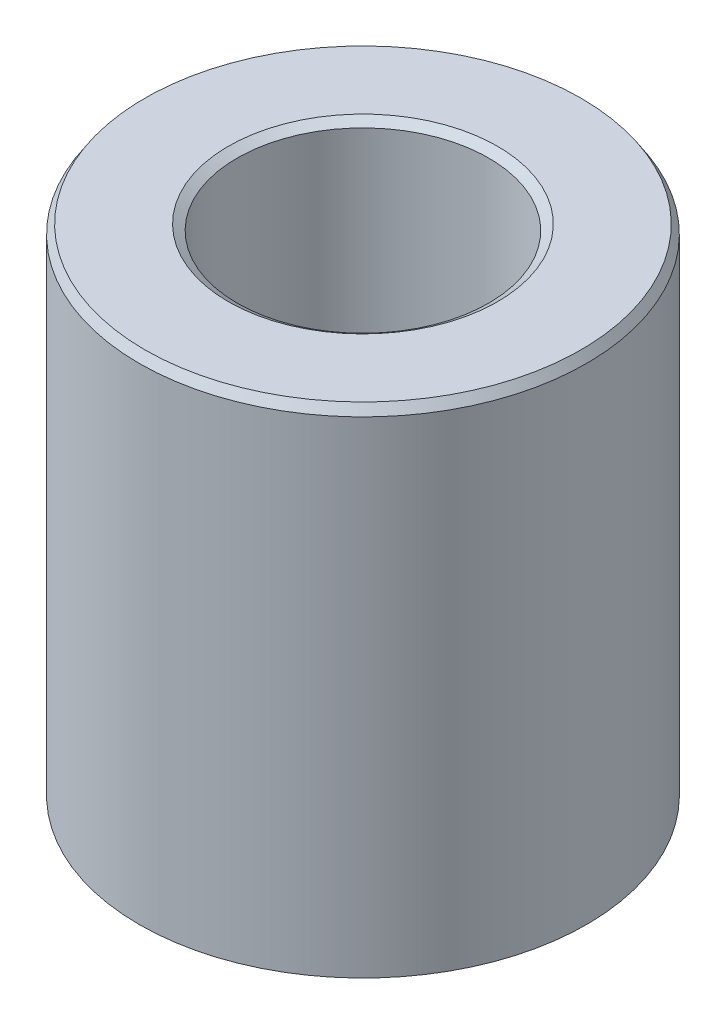
from build123d import *
from OCP.BRepFilletAPI import BRepFilletAPI_MakeChamfer

# Parameters (mm, degrees)
SKETCH1_R           = 32.5
BOSS_EXTRUDE1_DEPTH = 72.711020026
SKETCH2_R           = 18.267022671
CUT_EXTRUDE1_DEPTH  = 87.019721188
CHAMFER1_SIZE       = 1.29037095
CHAMFER1_SIZE2      = 0.829573823


with BuildPart() as part:
    # Sketch1 → Boss-Extrude1 (new body)
    with BuildSketch(Plane(origin=(0, 0, 0), x_dir=(1, 0, 0), z_dir=(0, 1, 0))):
        Circle(SKETCH1_R)
    extrude(amount=BOSS_EXTRUDE1_DEPTH)

    # Sketch2 → Cut-Extrude1 (cut, through all)
    with BuildSketch(Plane(origin=(0, 0, 0), x_dir=(1, 0, 0), z_dir=(0, 1, 0))):
        Circle(SKETCH2_R)
    extrude(amount=CUT_EXTRUDE1_DEPTH, mode=Mode.SUBTRACT)

    # Chamfer1: one chamfer whose edges measure the first distance from different faces: ONE call of the kernel's chamfer builder (chamfer() names one face for all edges)
    chamfer1_edges_1 = [part.edges().sort_by_distance(p)[0] for p in [
        (-18.267022671, 72.711020026, 0),
    ]]
    chamfer1_side_1 = [part.faces().sort_by_distance(p)[0] for p in [
        (-31.580761184, 72.711020026, 0),
    ]]
    chamfer1_edges_2 = [part.edges().sort_by_distance(p)[0] for p in [
        (-18.267022671, 0, 0),
    ]]
    chamfer1_side_2 = [part.faces().sort_by_distance(p)[0] for p in [
        (-18.267022671, 36.355510013, 0),
    ]]
    chamfer1_edges_3 = [part.edges().sort_by_distance(p)[0] for p in [
        (-32.5, 0, 0),
    ]]
    chamfer1_side_3 = [part.faces().sort_by_distance(p)[0] for p in [
        (-31.580761184, 0, 0),
    ]]
    chamfer1_edges_4 = [part.edges().sort_by_distance(p)[0] for p in [
        (-32.5, 72.711020026, 0),
    ]]
    chamfer1_side_4 = [part.faces().sort_by_distance(p)[0] for p in [
        (-32.5, 36.355510013, 0),
    ]]
    chamfer1 = BRepFilletAPI_MakeChamfer(part.part.solid().wrapped)
    for e in chamfer1_edges_1:
        chamfer1.Add(CHAMFER1_SIZE, CHAMFER1_SIZE2, e.wrapped, chamfer1_side_1[0].wrapped)  # the first distance lies on this face
    for e in chamfer1_edges_2:
        chamfer1.Add(CHAMFER1_SIZE, CHAMFER1_SIZE2, e.wrapped, chamfer1_side_2[0].wrapped)  # the first distance lies on this face
    for e in chamfer1_edges_3:
        chamfer1.Add(CHAMFER1_SIZE, CHAMFER1_SIZE2, e.wrapped, chamfer1_side_3[0].wrapped)  # the first distance lies on this face
    for e in chamfer1_edges_4:
        chamfer1.Add(CHAMFER1_SIZE, CHAMFER1_SIZE2, e.wrapped, chamfer1_side_4[0].wrapped)  # the first distance lies on this face
    add(Compound.cast(chamfer1.Shape()), mode=Mode.REPLACE)


solid = part.part
